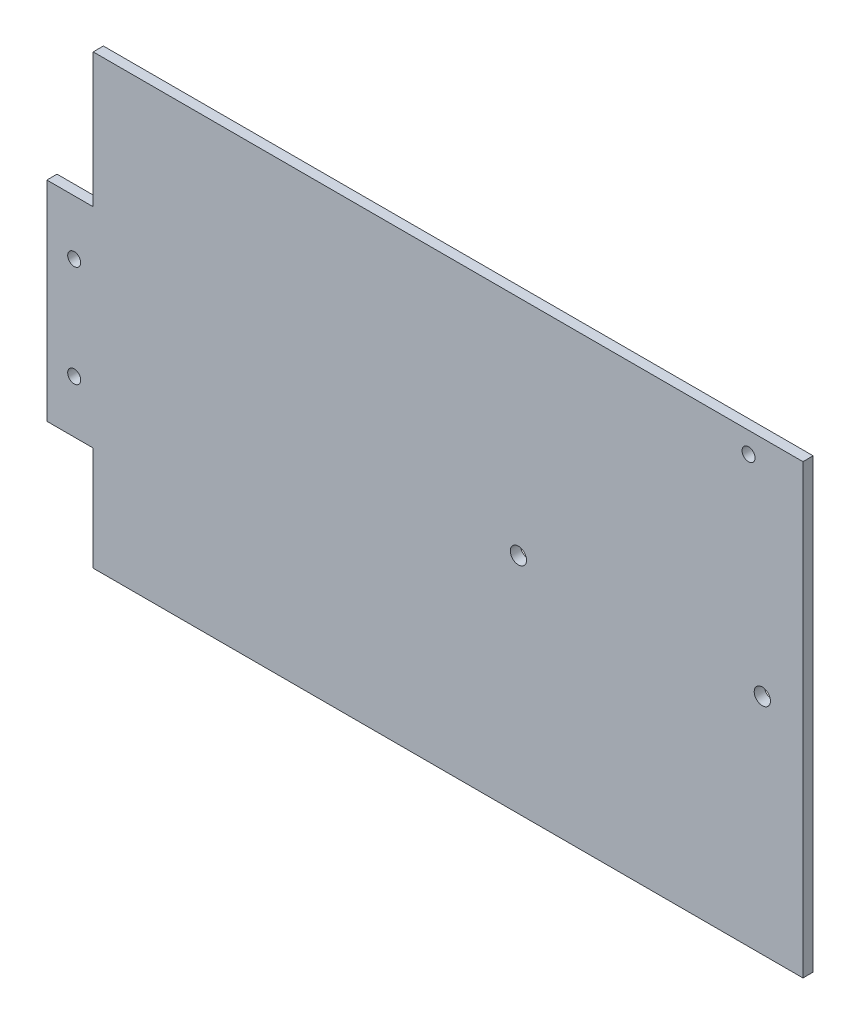
from build123d import *

# Parameters (mm, degrees)
BOSS_EXTRUDE3_DEPTH = 3.175
SKETCH3_R           = 2.032
CUT_EXTRUDE2_DEPTH  = 275.455932756
SKETCH4_R           = 2.032
CUT_EXTRUDE3_DEPTH  = 275.455932756
SKETCH5_R           = 2.54
CUT_EXTRUDE4_DEPTH  = 275.455932756


with BuildPart() as part:
    # Sketch1 → Boss-Extrude3 (new body)
    with BuildSketch(Plane.XY):
        Polygon((-221.742, 0), (0, 0), (0, 139.7), (-221.742, 139.7), (-221.742, 97.79), (-236.22, 97.79), (-236.22, 32.512), (-221.742, 32.512), align=None)
    extrude(amount=BOSS_EXTRUDE3_DEPTH)

    # Sketch3 → Cut-Extrude2 (cut, through all)
    with BuildSketch(Plane(origin=(0, 0, 0), x_dir=(-1, 0, 0), z_dir=(0, 0, -1))):
        with Locations((227.680130405, 80.681331583)):
            Circle(SKETCH3_R)
        with Locations((227.680130405, 48.931331583)):
            Circle(SKETCH3_R)
    extrude(amount=-CUT_EXTRUDE2_DEPTH, mode=Mode.SUBTRACT)

    # Sketch4 → Cut-Extrude3 (cut, through all)
    with BuildSketch(Plane.XY.offset(3.175)):
        with Locations((-17, 133.2)):
            Circle(SKETCH4_R)
    extrude(amount=-CUT_EXTRUDE3_DEPTH, mode=Mode.SUBTRACT)

    # Sketch5 → Cut-Extrude4 (cut, through all)
    with BuildSketch(Plane.XY.offset(3.175)):
        with Locations((-88.9, 69.85)):
            Circle(SKETCH5_R)
        with Locations((-12.7, 69.85)):
            Circle(SKETCH5_R)
    extrude(amount=-CUT_EXTRUDE4_DEPTH, mode=Mode.SUBTRACT)


solid = part.part
